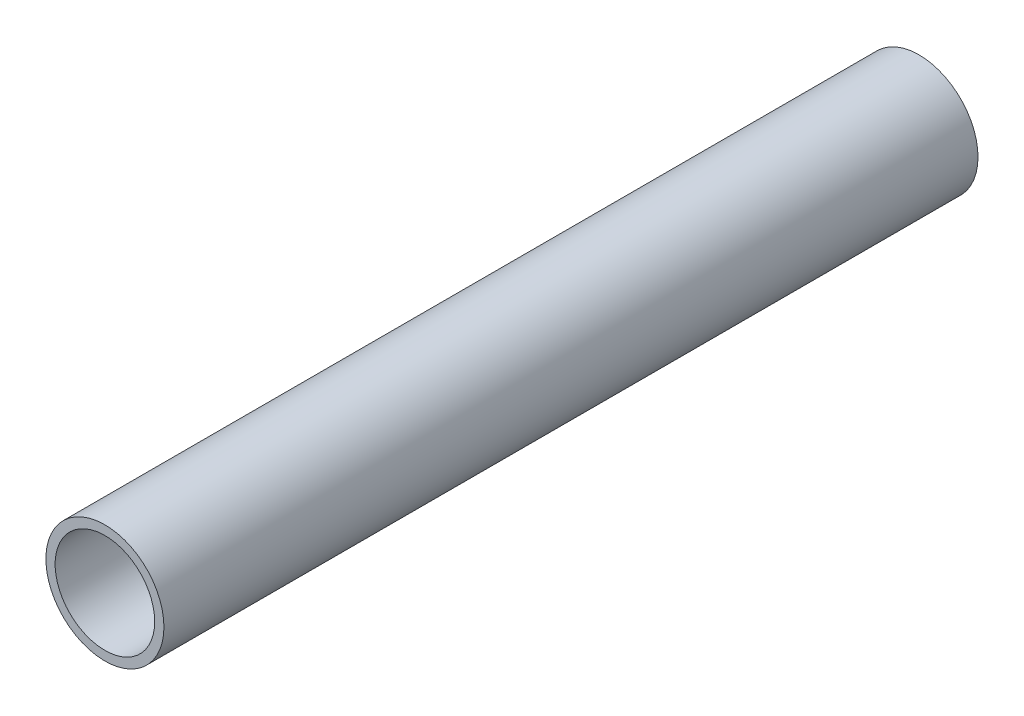
from build123d import *

# Parameters (mm, degrees)
SKETCH3_R           = 7.9375
SKETCH3_R_2         = 6.6929
BOSS_EXTRUDE1_DEPTH = 54.736386844


with BuildPart() as part:
    # Sketch3 → Boss-Extrude1 (new, symmetric)
    with BuildSketch(Plane.XY):
        Circle(SKETCH3_R)
        Circle(SKETCH3_R_2, mode=Mode.SUBTRACT)
    extrude(amount=BOSS_EXTRUDE1_DEPTH, both=True)


solid = part.part
